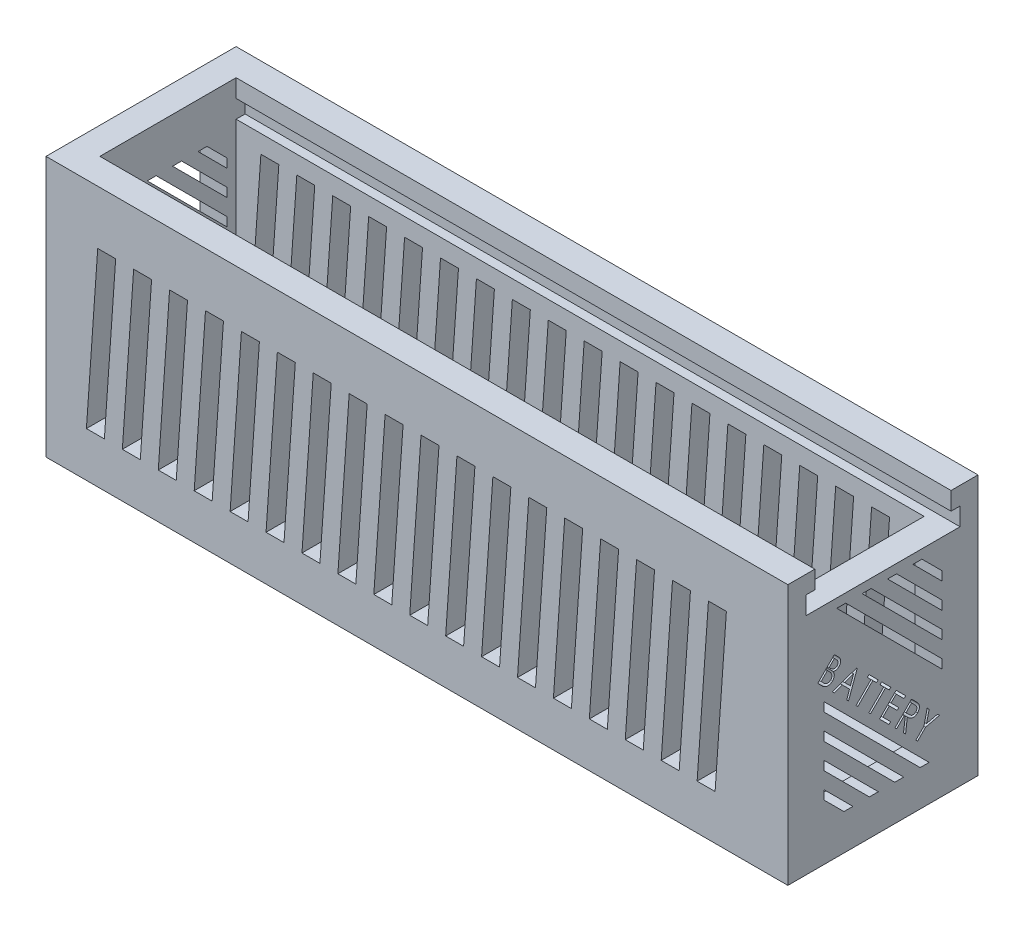
from build123d import *

# Parameters (mm, degrees)
SKETCH2_W                      = 82.606546826
SKETCH2_H                      = 21.167927624
BOSS_EXTRUDE1_DEPTH            = 25
SHELL1_T                       = -3
CUT_EXTRUDE1_REACH             = 53.585
CUT_EXTRUDE1_DIRECTION_2_DEPTH = 25
LPATTERN1_COUNT                = 18
LPATTERN1_PITCH                = 4
CUT_EXTRUDE2_REACH             = 86.108
CUT_EXTRUDE2_DIRECTION_2_REACH = 86.108
LPATTERN2_START                = -41.303273413
LPATTERN2_DEPTH                = 82.606546826
CUT_EXTRUDE3_REACH             = 86.108
CUT_EXTRUDE3_DIRECTION_2_REACH = 86.108
LPATTERN3_START                = -41.303273413
LPATTERN3_DEPTH                = 82.606546826
CUT_EXTRUDE10_REACH            = 86.108
BOSS_EXTRUDE2_DEPTH            = 82.606546826
BOSS_EXTRUDE3_DEPTH            = 3


# Read off the part's stored shape, not the designer's step: LPattern2, LPattern3
with BuildPart() as part:
    # Sketch2 → Boss-Extrude1 (new body)
    with BuildSketch(Plane(origin=(0, 0, 0), x_dir=(1, 0, 0), z_dir=(0, 1, 0))):
        Rectangle(SKETCH2_W, SKETCH2_H)
    extrude(amount=BOSS_EXTRUDE1_DEPTH)

    # Shell1
    shell1_openings = [part.faces().sort_by_distance(p)[0] for p in [
        (0, 25, 0),
    ]]
    offset(amount=SHELL1_T, openings=shell1_openings, kind=Kind.INTERSECTION)

    # Sketch3 → Cut-Extrude1 (cut, up to next)
    with BuildSketch(Plane(origin=(0, 0, 7.583963812), x_dir=(-1, 0, 0), z_dir=(0, 0, -1)), mode=Mode.PRIVATE) as cut_extrude1_sk1:
        Polygon((35.544590798, 23), (33.544590798, 23), (34.803273413, 5), (36.803273413, 5), align=None)
    cut_extrude1_tool1 = extrude(cut_extrude1_sk1.sketch, amount=-CUT_EXTRUDE1_REACH, mode=Mode.PRIVATE) & part.part
    cut_extrude1 = cut_extrude1_tool1.solids().sort_by_distance((-35.173932, 14, 7.583964))[0]
    add(cut_extrude1, mode=Mode.SUBTRACT)

    # Sketch3 → Cut-Extrude1 direction 2 (cut)
    with BuildSketch(Plane(origin=(0, 0, 7.583963812), x_dir=(-1, 0, 0), z_dir=(0, 0, -1))):
        Polygon((35.544590798, 23), (33.544590798, 23), (34.803273413, 5), (36.803273413, 5), align=None)
    cut_extrude1_direction_2 = extrude(amount=CUT_EXTRUDE1_DIRECTION_2_DEPTH, mode=Mode.SUBTRACT)

    # LPattern1: Cut-Extrude1, Cut-Extrude1 direction 2 ×18
    with Locations(*[(i * LPATTERN1_PITCH, 0, 0) for i in range(1, LPATTERN1_COUNT)]):
        add(cut_extrude1, mode=Mode.SUBTRACT)
        add(cut_extrude1_direction_2, mode=Mode.SUBTRACT)

    # Sketch4 → Cut-Extrude2 (cut, up to next)
    with BuildSketch(Plane.ZY.offset(38.303273413), mode=Mode.PRIVATE) as cut_extrude2_sk1:
        Polygon((-4.341323125, 24), (-3.341323125, 24), (-6.583963812, 20.757359313), (-6.583963812, 21.757359313), align=None)
    cut_extrude2_tool1 = extrude(cut_extrude2_sk1.sketch, amount=CUT_EXTRUDE2_REACH, mode=Mode.PRIVATE) & part.part
    add(cut_extrude2_tool1.solids().sort_by_distance((-38.303273, 22.613487, -5.197451))[0], mode=Mode.SUBTRACT)

    # Sketch4 → Cut-Extrude2 direction 2 (cut, up to next)
    with BuildSketch(Plane.ZY.offset(38.303273413), mode=Mode.PRIVATE) as cut_extrude2_direction_2_sk1:
        Polygon((-4.341323125, 24), (-3.341323125, 24), (-6.583963812, 20.757359313), (-6.583963812, 21.757359313), align=None)
    cut_extrude2_direction_2_tool1 = extrude(cut_extrude2_direction_2_sk1.sketch, amount=-CUT_EXTRUDE2_DIRECTION_2_REACH, mode=Mode.PRIVATE) & part.part
    add(cut_extrude2_direction_2_tool1.solids().sort_by_distance((-38.303273, 22.613487, -5.197451))[0], mode=Mode.SUBTRACT)

    # LPattern2 outline → LPattern2 (cut)
    with BuildSketch(Plane.YZ.offset(LPATTERN2_START)):
        Polygon((24, -0.512896), (17.928932188, -6.583963812), (18.928932188, -6.583963812), (24, -1.512896), align=None)
        Polygon((24, 2.315531125), (15.100505063, -6.583963812), (16.100505063, -6.583963812), (24, 1.315531125), align=None)
        Polygon((24, 5.143958249), (12.272077939, -6.583963812), (13.272077939, -6.583963812), (24, 4.143958249), align=None)
    extrude(amount=LPATTERN2_DEPTH, mode=Mode.SUBTRACT)

    # Sketch6 → Cut-Extrude3 (cut, up to next)
    with BuildSketch(Plane(origin=(-38.303273413, 0, 0), x_dir=(0, 0, -1), z_dir=(1, 0, 0)), mode=Mode.PRIVATE) as cut_extrude3_sk1:
        Polygon((-6.583963812, 7.242640687), (-6.583963812, 6.242640687), (-4.341323125, 4), (-3.341323125, 4), align=None)
    cut_extrude3_tool1 = extrude(cut_extrude3_sk1.sketch, amount=-CUT_EXTRUDE3_REACH, mode=Mode.PRIVATE) & part.part
    add(cut_extrude3_tool1.solids().sort_by_distance((-38.303273, 5.386513, 5.197451))[0], mode=Mode.SUBTRACT)

    # Sketch6 → Cut-Extrude3 direction 2 (cut, up to next)
    with BuildSketch(Plane(origin=(-38.303273413, 0, 0), x_dir=(0, 0, -1), z_dir=(1, 0, 0)), mode=Mode.PRIVATE) as cut_extrude3_direction_2_sk1:
        Polygon((-6.583963812, 7.242640687), (-6.583963812, 6.242640687), (-4.341323125, 4), (-3.341323125, 4), align=None)
    cut_extrude3_direction_2_tool1 = extrude(cut_extrude3_direction_2_sk1.sketch, amount=CUT_EXTRUDE3_DIRECTION_2_REACH, mode=Mode.PRIVATE) & part.part
    add(cut_extrude3_direction_2_tool1.solids().sort_by_distance((-38.303273, 5.386513, 5.197451))[0], mode=Mode.SUBTRACT)

    # LPattern3 outline → LPattern3 (cut)
    with BuildSketch(Plane.YZ.offset(LPATTERN3_START)):
        Polygon((4, -5.143958249), (15.727922061, 6.583963812), (14.727922061, 6.583963812), (4, -4.143958249), align=None)
        Polygon((4, 0.512896), (10.071067812, 6.583963812), (9.071067812, 6.583963812), (4, 1.512896), align=None)
        Polygon((4, -2.315531125), (12.899494937, 6.583963812), (11.899494937, 6.583963812), (4, -1.315531125), align=None)
    extrude(amount=LPATTERN3_DEPTH, mode=Mode.SUBTRACT)

    # Sketch10 → Cut-Extrude10 (cut, up to next)
    with BuildSketch(Plane.ZY.offset(-38.303273413), mode=Mode.PRIVATE) as cut_extrude10_sk1:
        with BuildLine():
            Line((5.406237039, 19.668151506), (5.041586932, 19.303501399))
            add(Edge.make_bspline(
                [(5.041586932, 19.303501399), (5.024038201, 19.28536155), (4.989971851, 19.250147698), (4.94134101, 19.197944583), (4.898492917, 19.146392149), (4.860382676, 19.096650889), (4.826526326, 19.04882292), (4.797943116, 19.00221017), (4.773888025, 18.957135356), (4.748542996, 18.899646963), (4.72651075, 18.827758285), (4.712663472, 18.740438021), (4.713640495, 18.652304199), (4.72695405, 18.564580475), (4.752081303, 18.47895473), (4.789667613, 18.398135818), (4.838753281, 18.322707449), (4.879770312, 18.278596498), (4.900603025, 18.256192371)],
                knots=[0, 0, 0, 0, 1.010039783, 1.960732594, 2.854180912, 3.691307208, 4.468005985, 5.197960132, 5.877927144, 6.511073573, 7.709718577, 8.875597696, 10.035092746, 11.221940952, 12.416492297, 13.593189445, 14.77757135, 16, 16, 16, 16], degree=3))
            add(Edge.make_bspline(
                [(4.900603025, 18.256192371), (4.921459506, 18.236650752), (4.96251416, 18.19818432), (5.032549415, 18.152018331), (5.106678206, 18.11542839), (5.185588792, 18.089881297), (5.267848216, 18.075787002), (5.352918888, 18.072230201), (5.440134257, 18.082095907), (5.497727001, 18.097007933), (5.527080389, 18.10460817)],
                knots=[0, 0, 0, 0, 1.009361854, 1.986864539, 2.953844043, 3.926119456, 4.909298338, 5.897350454, 6.928339162, 8, 8, 8, 8], degree=3))
            add(Edge.make_bspline(
                [(5.527080389, 18.10460817), (5.512518038, 18.073527824), (5.484767166, 18.01429929), (5.451764614, 17.92664363), (5.430420629, 17.844873098), (5.418536655, 17.768444307), (5.416807683, 17.69553615), (5.421631546, 17.6241795), (5.435922215, 17.553899135), (5.457058894, 17.484958933), (5.485535312, 17.417859668), (5.522517656, 17.354379146), (5.566032781, 17.29348917), (5.60064434, 17.257077847), (5.618242915, 17.238564166)],
                knots=[0, 0, 0, 0, 1.315874709, 2.507608225, 3.585498209, 4.551237979, 5.466196096, 6.376502642, 7.28791766, 8.209348528, 9.138022758, 10.075770395, 11.021607253, 12, 12, 12, 12], degree=3))
            add(Edge.make_bspline(
                [(5.618242915, 17.238564166), (5.637004403, 17.220883396), (5.673956774, 17.18605959), (5.734240277, 17.140766553), (5.797624772, 17.102835243), (5.864142954, 17.072509173), (5.933679137, 17.049668788), (6.005924261, 17.033605084), (6.08124839, 17.025422725), (6.158626657, 17.023576708), (6.236916144, 17.030111397), (6.314772144, 17.044003516), (6.390756115, 17.068198432), (6.466133285, 17.098517149), (6.539305721, 17.139082834), (6.611671305, 17.18679182), (6.6825359, 17.243317233), (6.727015216, 17.286071589), (6.749824279, 17.30799609)],
                knots=[0, 0, 0, 0, 0.973618807, 1.917626368, 2.842748053, 3.759934448, 4.674078596, 5.603861842, 6.551239227, 7.532836595, 8.524148287, 9.515392535, 10.514251514, 11.532117037, 12.580696629, 13.669460725, 14.804895817, 16, 16, 16, 16], degree=3))
            Line((6.749824279, 17.30799609), (7.258108367, 17.816280178))
            Line((7.258108367, 17.816280178), (5.406237039, 19.668151506))
        make_face()
        with BuildLine():
            Line((5.406237039, 19.305621458), (5.999323477, 18.712535019))
            Line((5.999323477, 18.712535019), (5.893850554, 18.607062096))
            add(Edge.make_bspline(
                [(5.893850554, 18.607062096), (5.878199212, 18.591617532), (5.847954851, 18.561772744), (5.803075121, 18.519843176), (5.759783932, 18.482550415), (5.718912553, 18.449308965), (5.679997211, 18.420496423), (5.643377741, 18.395790763), (5.608568854, 18.375783068), (5.565566028, 18.354438029), (5.512374253, 18.335216701), (5.447586292, 18.323098058), (5.382381174, 18.320187607), (5.317524891, 18.327759308), (5.254632225, 18.344558306), (5.195643446, 18.370462734), (5.140542529, 18.404275675), (5.108972175, 18.433699816), (5.092998357, 18.448587704)],
                knots=[0, 0, 0, 0, 1.139072835, 2.201123148, 3.180922261, 4.098564989, 4.929603435, 5.688574638, 6.38558588, 7.007733967, 8.174379991, 9.301625663, 10.40998766, 11.542977531, 12.670780372, 13.769197616, 14.871269156, 16, 16, 16, 16], degree=3))
            add(Edge.make_bspline(
                [(5.092998357, 18.448587704), (5.082856544, 18.459151507), (5.06308814, 18.479742453), (5.03819353, 18.513574302), (5.01717146, 18.547979933), (5.001240879, 18.583865249), (4.989489319, 18.620648905), (4.98189722, 18.658500965), (4.979301504, 18.697506966), (4.981534408, 18.737523354), (4.988463496, 18.778636366), (5.000828352, 18.820812203), (5.018963452, 18.863834359), (5.043412906, 18.907447584), (5.07256687, 18.952453172), (5.107030552, 18.998695568), (5.147760269, 19.045303583), (5.177316416, 19.076072183), (5.192641119, 19.092025538)],
                knots=[0, 0, 0, 0, 0.948557859, 1.848927212, 2.71724673, 3.558159299, 4.387760741, 5.216729262, 6.05490664, 6.915255925, 7.809776763, 8.752297874, 9.758582881, 10.830042875, 11.989777664, 13.233797524, 14.565738862, 16, 16, 16, 16], degree=3))
            Line((5.192641119, 19.092025538), (5.406237039, 19.305621458))
        make_face(mode=Mode.SUBTRACT)
        with BuildLine():
            Line((6.185358634, 18.526499863), (6.895578319, 17.816280178))
            Line((6.895578319, 17.816280178), (6.666611972, 17.587313832))
            add(Edge.make_bspline(
                [(6.666611972, 17.587313832), (6.650279858, 17.571134478), (6.618580348, 17.539731467), (6.571212458, 17.496064272), (6.525860581, 17.4568852), (6.482441359, 17.422782369), (6.441965013, 17.392121921), (6.402829698, 17.367083301), (6.366093099, 17.34637007), (6.320126412, 17.325077185), (6.263219936, 17.306612434), (6.194024374, 17.294102838), (6.123810907, 17.291907217), (6.053853116, 17.300511444), (5.986178714, 17.318592857), (5.922451388, 17.344682104), (5.864756933, 17.381484867), (5.831251362, 17.411903629), (5.814348351, 17.427249396)],
                knots=[0, 0, 0, 0, 1.124283346, 2.182156578, 3.150297016, 4.054434607, 4.882226797, 5.63242387, 6.324810436, 6.943388099, 8.107411426, 9.239635659, 10.372090665, 11.529585415, 12.673943896, 13.789259634, 14.884717733, 16, 16, 16, 16], degree=3))
            add(Edge.make_bspline(
                [(5.814348351, 17.427249396), (5.804445016, 17.437685261), (5.785001527, 17.458174282), (5.759250347, 17.49152583), (5.737154042, 17.526328721), (5.718147415, 17.562729409), (5.703685538, 17.600942542), (5.69165004, 17.64034399), (5.683951823, 17.681419076), (5.677413306, 17.737964379), (5.678876101, 17.810728854), (5.69592685, 17.898325453), (5.727455469, 17.986391297), (5.758881273, 18.041960161), (5.775127264, 18.07068723)],
                knots=[0, 0, 0, 0, 0.741244022, 1.455304822, 2.167737733, 2.864218412, 3.56774849, 4.270806875, 4.985216026, 5.718360007, 7.203028222, 8.714052242, 10.301285311, 12, 12, 12, 12], degree=3))
            add(Edge.make_bspline(
                [(5.775127264, 18.07068723), (5.781894109, 18.08119689), (5.796391991, 18.103713707), (5.822488146, 18.138084421), (5.852264313, 18.17708414), (5.88893056, 18.218523341), (5.92929681, 18.26467649), (5.97520274, 18.31403425), (6.026066935, 18.367065134), (6.062154005, 18.403246258), (6.08094574, 18.422086969)],
                knots=[0, 0, 0, 0, 0.642612026, 1.376788289, 2.218319108, 3.165410458, 4.221040441, 5.371965022, 6.631494974, 8, 8, 8, 8], degree=3))
            Line((6.08094574, 18.422086969), (6.185358634, 18.526499863))
        make_face(mode=Mode.SUBTRACT)
    cut_extrude10_tool1 = extrude(cut_extrude10_sk1.sketch, amount=-CUT_EXTRUDE10_REACH, mode=Mode.PRIVATE) & part.part
    # Sketch10 → Cut-Extrude10 (cut, up to next)
    with BuildSketch(Plane.ZY.offset(-38.303273413), mode=Mode.PRIVATE) as cut_extrude10_sk2:
        Polygon((2.850949552, 17.112864018), (3.839426949, 14.397598761), (4.038182458, 14.596354269), (3.719643629, 15.496849228), (4.517845752, 16.295051351), (5.416750667, 15.974922479), (5.623456396, 16.181628208), (2.896530815, 17.158445282), align=None)
        Polygon((3.266481069, 16.742913765), (4.256018495, 16.390453996), (3.622650941, 15.757086441), align=None, mode=Mode.SUBTRACT)
    cut_extrude10_tool2 = extrude(cut_extrude10_sk2.sketch, amount=-CUT_EXTRUDE10_REACH, mode=Mode.PRIVATE) & part.part
    # Sketch10 → Cut-Extrude10 (cut, up to next)
    with BuildSketch(Plane.ZY.offset(-38.303273413), mode=Mode.PRIVATE) as cut_extrude10_sk3:
        Polygon((1.736460882, 15.637965359), (1.556255887, 15.818170354), (0.540217726, 14.802132193), (0.720422721, 14.621927198), (1.133304164, 15.034808642), (2.804970497, 13.363142309), (2.993655727, 13.551827539), (1.321989394, 15.223493871), align=None)
    cut_extrude10_tool3 = extrude(cut_extrude10_sk3.sketch, amount=-CUT_EXTRUDE10_REACH, mode=Mode.PRIVATE) & part.part
    # Sketch10 → Cut-Extrude10 (cut, up to next)
    with BuildSketch(Plane.ZY.offset(-38.303273413), mode=Mode.PRIVATE) as cut_extrude10_sk4:
        Polygon((0.316505854, 14.218010331), (0.13630086, 14.398215326), (-0.879737302, 13.382177165), (-0.699532307, 13.20197217), (-0.286650863, 13.614853614), (1.38501547, 11.943187281), (1.573700699, 12.131872511), (-0.097965634, 13.803538844), align=None)
    cut_extrude10_tool4 = extrude(cut_extrude10_sk4.sketch, amount=-CUT_EXTRUDE10_REACH, mode=Mode.PRIVATE) & part.part
    # Sketch10 → Cut-Extrude10 (cut, up to next)
    with BuildSketch(Plane.ZY.offset(-38.303273413), mode=Mode.PRIVATE) as cut_extrude10_sk5:
        Polygon((-1.46915931, 12.792755157), (-2.530248719, 11.731665747), (-2.347393651, 11.548810679), (-1.471279368, 12.424924962), (-0.892503327, 11.84614892), (-1.760667389, 10.977984858), (-1.579402365, 10.796719834), (-0.711238303, 11.664883896), (0.015411837, 10.938233756), (-0.852752225, 10.070069693), (-0.670427172, 9.88774464), (0.382712018, 10.940883829), align=None)
    cut_extrude10_tool5 = extrude(cut_extrude10_sk5.sketch, amount=-CUT_EXTRUDE10_REACH, mode=Mode.PRIVATE) & part.part
    # Sketch10 → Cut-Extrude10 (cut, up to next)
    with BuildSketch(Plane.ZY.offset(-38.303273413), mode=Mode.PRIVATE) as cut_extrude10_sk6:
        with BuildLine():
            Line((-3.185423294, 11.076491172), (-3.554313519, 10.707600948))
            add(Edge.make_bspline(
                [(-3.554313519, 10.707600948), (-3.578955522, 10.682950404), (-3.626300581, 10.635588935), (-3.692805026, 10.566392715), (-3.7521806, 10.502631468), (-3.805111257, 10.44490033), (-3.850440002, 10.391996841), (-3.88932, 10.34479172), (-3.921578102, 10.303292069), (-3.939083706, 10.276278529), (-3.947054404, 10.263978652)],
                knots=[0, 0, 0, 0, 1.409711453, 2.708500253, 3.88142262, 4.933597437, 5.87605745, 6.698576892, 7.407432613, 8, 8, 8, 8], degree=3))
            add(Edge.make_bspline(
                [(-3.947054404, 10.263978652), (-3.957247594, 10.247182893), (-3.977409095, 10.213961916), (-4.002084051, 10.161849773), (-4.022588845, 10.109131321), (-4.037640989, 10.055621873), (-4.049228565, 10.001504859), (-4.055408185, 9.946489606), (-4.057090206, 9.890632101), (-4.053627495, 9.834483514), (-4.046671043, 9.778514212), (-4.033715711, 9.72351323), (-4.01576538, 9.670109141), (-3.992605729, 9.61826912), (-3.964979611, 9.567619177), (-3.932131375, 9.518530057), (-3.89418777, 9.470826071), (-3.865682007, 9.441172149), (-3.851121745, 9.426025427)],
                knots=[0, 0, 0, 0, 1.028975335, 2.035249736, 3.017033968, 3.989916027, 4.945014059, 5.914276982, 6.886806547, 7.869768737, 8.859682656, 9.83884413, 10.825505525, 11.807857098, 12.810547404, 13.84537903, 14.899456017, 16, 16, 16, 16], degree=3))
            add(Edge.make_bspline(
                [(-3.851121745, 9.426025427), (-3.825757634, 9.402325494), (-3.776374828, 9.356182769), (-3.693411103, 9.300445271), (-3.606364227, 9.258114752), (-3.515345163, 9.229144437), (-3.421821224, 9.214876614), (-3.326894292, 9.214773458), (-3.231444124, 9.229901469), (-3.152442427, 9.255058538), (-3.088586631, 9.282247588), (-3.038954562, 9.308385076), (-2.987954059, 9.339390773), (-2.935312253, 9.374978891), (-2.881481439, 9.415819196), (-2.826372358, 9.461505834), (-2.769925086, 9.512027442), (-2.732827713, 9.548311149), (-2.71371022, 9.567009335)],
                knots=[0, 0, 0, 0, 1.277134705, 2.486524924, 3.665375341, 4.832435783, 5.991265076, 7.136694286, 8.315814143, 9.536446802, 10.1807836, 10.870675072, 11.600629768, 12.378615622, 13.210357497, 14.088640356, 15.015013645, 16, 16, 16, 16], degree=3))
            Line((-2.71371022, 9.567009335), (-2.518134799, 8.040037012))
            Line((-2.518134799, 8.040037012), (-2.289168453, 8.269003358))
            Line((-2.289168453, 8.269003358), (-2.485803903, 9.794915651))
            Line((-2.485803903, 9.794915651), (-2.379800965, 9.90091859))
            Line((-2.379800965, 9.90091859), (-1.518527094, 9.039644718))
            Line((-1.518527094, 9.039644718), (-1.333551967, 9.224619845))
            Line((-1.333551967, 9.224619845), (-3.185423294, 11.076491172))
        make_face()
        with BuildLine():
            Line((-3.189133397, 10.710251021), (-2.559475945, 10.080593569))
            Line((-2.559475945, 10.080593569), (-2.875364701, 9.759404667))
            add(Edge.make_bspline(
                [(-2.875364701, 9.759404667), (-2.890311624, 9.744669311), (-2.919324907, 9.716066697), (-2.962603897, 9.675710932), (-3.004428566, 9.639986034), (-3.043662964, 9.607701447), (-3.081487032, 9.580128225), (-3.117275972, 9.556240499), (-3.15120199, 9.536452152), (-3.193294915, 9.516049645), (-3.245439109, 9.497720404), (-3.308729906, 9.485749491), (-3.37267618, 9.484786074), (-3.4360059, 9.494068005), (-3.497849416, 9.511841519), (-3.556209242, 9.538691477), (-3.610648894, 9.573953207), (-3.642523601, 9.603434558), (-3.658726413, 9.61842076)],
                knots=[0, 0, 0, 0, 1.110572836, 2.155718917, 3.130117975, 4.02069038, 4.843373717, 5.605628497, 6.296690594, 6.919653771, 8.078588357, 9.20985942, 10.313090197, 11.446059402, 12.585028893, 13.706057082, 14.833924189, 16, 16, 16, 16], degree=3))
            add(Edge.make_bspline(
                [(-3.658726413, 9.61842076), (-3.673389062, 9.634253724), (-3.70233054, 9.665505195), (-3.736181325, 9.719301876), (-3.762304062, 9.776817162), (-3.778651341, 9.837913406), (-3.787516906, 9.900081347), (-3.786520892, 9.961814501), (-3.775698344, 10.022081654), (-3.758682038, 10.071070701), (-3.739571512, 10.110818573), (-3.72033231, 10.142900129), (-3.696766616, 10.177422085), (-3.669244405, 10.21442464), (-3.637377128, 10.253801553), (-3.600503997, 10.294936657), (-3.55974197, 10.33916178), (-3.530382711, 10.368837102), (-3.515092432, 10.384291987)],
                knots=[0, 0, 0, 0, 1.163298273, 2.296145069, 3.415124122, 4.563297614, 5.699514791, 6.796969846, 7.882538982, 8.992983099, 9.586178785, 10.262020953, 11.01096408, 11.843004241, 12.752018046, 13.745678516, 14.825951136, 16, 16, 16, 16], degree=3))
            Line((-3.515092432, 10.384291987), (-3.189133397, 10.710251021))
        make_face(mode=Mode.SUBTRACT)
    cut_extrude10_tool6 = extrude(cut_extrude10_sk6.sketch, amount=-CUT_EXTRUDE10_REACH, mode=Mode.PRIVATE) & part.part
    # Sketch10 → Cut-Extrude10 (cut, up to next)
    with BuildSketch(Plane.ZY.offset(-38.303273413), mode=Mode.PRIVATE) as cut_extrude10_sk7:
        Polygon((-4.929268539, 9.332645927), (-5.14286446, 9.119050007), (-4.852946424, 7.882525735), (-6.082050491, 8.179863976), (-6.296176425, 7.965738041), (-4.742703368, 7.585717508), (-3.857578836, 6.700592976), (-3.675253782, 6.882918029), (-4.560378315, 7.768042562), align=None)
    cut_extrude10_tool7 = extrude(cut_extrude10_sk7.sketch, amount=-CUT_EXTRUDE10_REACH, mode=Mode.PRIVATE) & part.part
    add(cut_extrude10_tool1.solids().sort_by_distance((38.303273, 18.254701, 5.87095))[0], mode=Mode.SUBTRACT)
    add(cut_extrude10_tool2.solids().sort_by_distance((38.303273, 15.768616, 3.381955))[0], mode=Mode.SUBTRACT)
    add(cut_extrude10_tool3.solids().sort_by_distance((38.303273, 14.63369, 1.723692))[0], mode=Mode.SUBTRACT)
    add(cut_extrude10_tool4.solids().sort_by_distance((38.303273, 13.213735, 0.303737))[0], mode=Mode.SUBTRACT)
    add(cut_extrude10_tool5.solids().sort_by_distance((38.303273, 11.48345, -0.958726))[0], mode=Mode.SUBTRACT)
    add(cut_extrude10_tool6.solids().sort_by_distance((38.303273, 9.738839, -2.837035))[0], mode=Mode.SUBTRACT)
    add(cut_extrude10_tool7.solids().sort_by_distance((38.303273, 9.199583, -5.009802))[0], mode=Mode.SUBTRACT)


with BuildPart() as cut_extrude10_piece_1:
    # of the separate pieces the step leaves, piece 1, a body of its own (cut_extrude10_pieces)
    add(part.part.solids().sort_by_distance((-41.303273413, 0, -10.583963812))[0])

    # Sketch12 → Boss-Extrude2 (add)
    with BuildSketch(Plane(origin=(41.303273413, 0, 0), x_dir=(0, 0, -1), z_dir=(1, 0, 0))):
        Polygon((-10.583963812, 25), (-10.583963812, 29), (-7.583963812, 29), (-7.583963812, 27), (-8.583963812, 27), (-8.583963812, 25), align=None)
        Polygon((8.583963812, 25), (10.583963812, 25), (10.583963812, 29), (7.583963812, 29), (7.583963812, 27), (8.583963812, 27), align=None)
    extrude(amount=-BOSS_EXTRUDE2_DEPTH)

    # Sketch13 → Boss-Extrude3 (add)
    with BuildSketch(Plane.ZY.offset(41.303273413)):
        Polygon((-7.583963812, 29), (-7.583963812, 27), (-8.583963812, 27), (-8.583963812, 25), (8.583963812, 25), (8.583963812, 27), (7.583963812, 27), (7.583963812, 29), align=None)
    extrude(amount=-BOSS_EXTRUDE3_DEPTH)


with BuildPart() as cut_extrude10_piece_2:
    # of the separate pieces the step leaves, piece 2, a body of its own (cut_extrude10_pieces)
    add(part.part.solids().sort_by_distance((41.303273413, 18.422086969, 6.08094574))[0])


with BuildPart() as cut_extrude10_piece_3:
    # of the separate pieces the step leaves, piece 3, a body of its own (cut_extrude10_pieces)
    add(part.part.solids().sort_by_distance((41.303273413, 10.384291987, -3.515092432))[0])


with BuildPart() as cut_extrude10_piece_4:
    # of the separate pieces the step leaves, piece 4, a body of its own (cut_extrude10_pieces)
    add(part.part.solids().sort_by_distance((41.303273413, 19.092025538, 5.192641119))[0])


with BuildPart() as cut_extrude10_piece_5:
    # of the separate pieces the step leaves, piece 5, a body of its own (cut_extrude10_pieces)
    add(part.part.solids().sort_by_distance((41.303273413, 15.757086441, 3.622650941))[0])


solid = Compound([cut_extrude10_piece_1.part, cut_extrude10_piece_2.part, cut_extrude10_piece_3.part, cut_extrude10_piece_4.part, cut_extrude10_piece_5.part])
